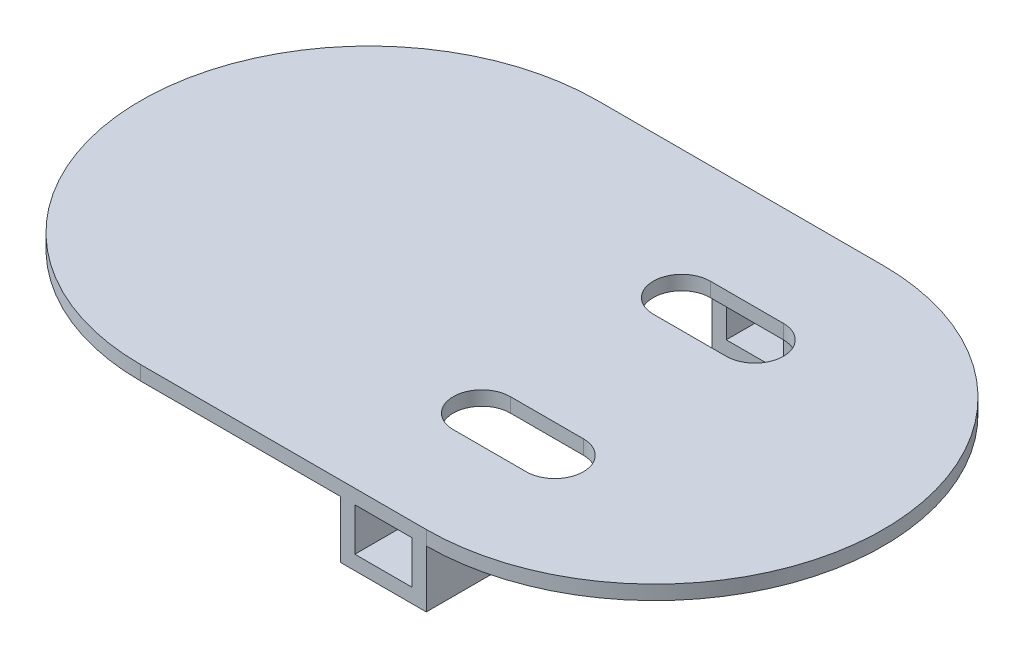
from build123d import *

# Parameters (mm, degrees)
BOSS_EXTRUDE2_DEPTH = 5
SKETCH4_W           = 30
SKETCH4_H           = 30
BOSS_EXTRUDE3_DEPTH = 20
SKETCH5_W           = 20
SKETCH5_H           = 15
CUT_EXTRUDE1_DEPTH  = 208.123151772
CUT_EXTRUDE2_DEPTH  = 20


with BuildPart() as part:
    # Sketch1 → Boss-Extrude2 (new body)
    with BuildSketch(Plane(origin=(0, 0, 0), x_dir=(1, 0, 0), z_dir=(0, 1, 0))):
        with BuildLine():
            Line((-50, 80), (50, 80))
            ThreePointArc((50, 80), (130, 0), (50, -80))
            Line((50, -80), (-50, -80))
            ThreePointArc((-50, -80), (-130, 0), (-50, 80))
        make_face()
    extrude(amount=BOSS_EXTRUDE2_DEPTH)

    # Sketch4 → Boss-Extrude3 (add)
    with BuildSketch(Plane.XZ):
        with Locations((35, 65)):
            Rectangle(SKETCH4_W, SKETCH4_H)
    boss_extrude3 = extrude(amount=BOSS_EXTRUDE3_DEPTH)

    # Sketch5 → Cut-Extrude1 (cut, through all)
    with BuildSketch(Plane.XY.offset(80)):
        with Locations((35, -7.5)):
            Rectangle(SKETCH5_W, SKETCH5_H)
    cut_extrude1 = extrude(amount=-CUT_EXTRUDE1_DEPTH, mode=Mode.SUBTRACT)

    # Sketch9 → Cut-Extrude2 (cut)
    with BuildSketch(Plane(origin=(0, 5, 0), x_dir=(1, 0, 0), z_dir=(0, 1, 0))):
        with BuildLine():
            Line((50, -45), (24.431347003, -45))
            ThreePointArc((24.431347003, -45), (14.431347003, -35), (24.431347003, -25))
            Line((24.431347003, -25), (50, -25))
            ThreePointArc((50, -25), (60, -35), (50, -45))
        make_face()
    cut_extrude2 = extrude(amount=-CUT_EXTRUDE2_DEPTH, mode=Mode.SUBTRACT)

    # Mirror1: Boss-Extrude3, Cut-Extrude1, Cut-Extrude2 across plane
    add(boss_extrude3.mirror(Plane.XY))
    add(cut_extrude1.mirror(Plane.XY), mode=Mode.SUBTRACT)
    add(cut_extrude2.mirror(Plane.XY), mode=Mode.SUBTRACT)


solid = part.part
